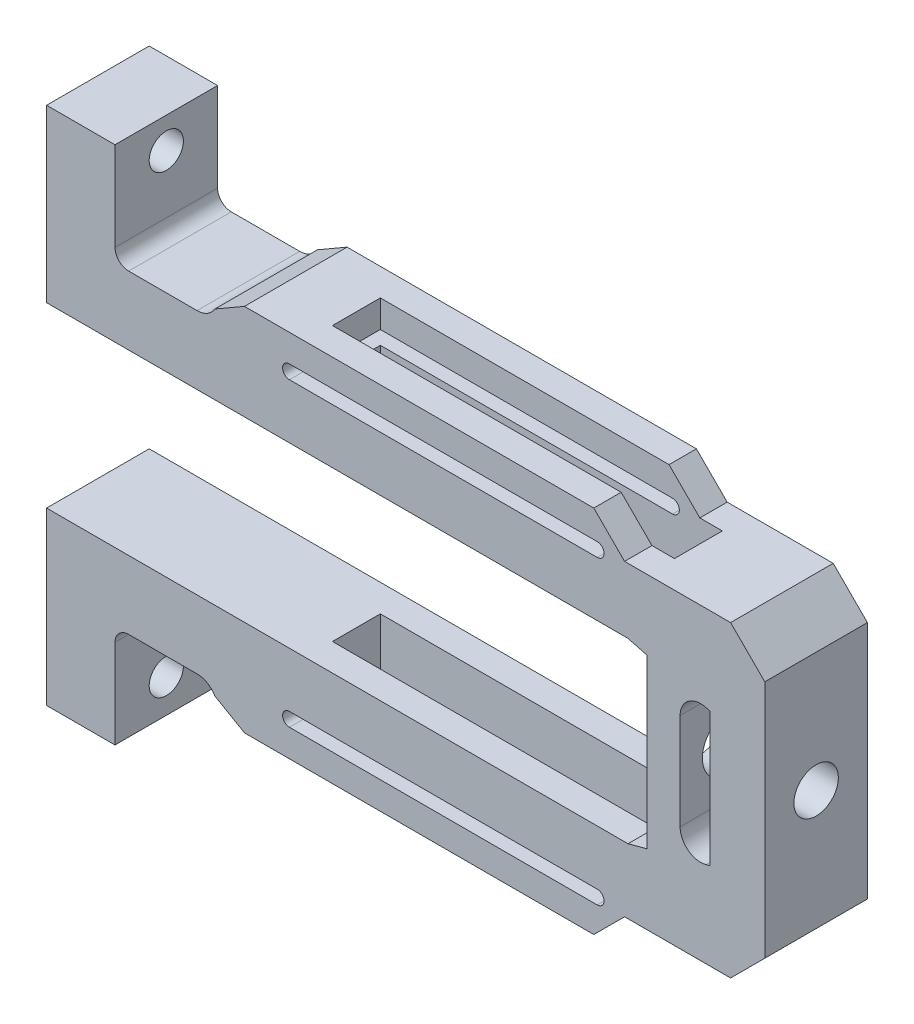
from build123d import *

# Parameters (mm, degrees)
BOSS_EXTRUDE1_DEPTH     = 7.5
SKETCH2_R               = 3.25
CUT_EXTRUDE1_DEPTH      = 112.91626334
FILLET1_R               = 2
SKETCH3_R               = 2.5
CUT_EXTRUDE2_DEPTH      = 103.592641062
CUT_EXTRUDE4_DEPTH      = 121.158229015
BOSS_EXTRUDE2_REACH     = 128.857
SKETCH7_W               = 5
SKETCH7_H               = 15
FILLET2_R               = 3
SKETCH8_R               = 4.25
CUT_EXTRUDE6_DEPTH      = 4.829629131
CUT_EXTRUDE3_DEPTH      = 125.202455692
CUT_EXTRUDE3_DEPTH_BACK = 125.202455692
SKETCH4_W               = 50
SKETCH4_H               = 7
CHAMFER1_START          = -7.5
CHAMFER1_DEPTH          = 15
CHAMFER2_SIZE           = 5


with BuildPart() as part:
    # Sketch1 → Boss-Extrude1 (new, symmetric)
    with BuildSketch(Plane.XY):
        Polygon((-28, 13), (-113, 13), (-113, 38), (-103, 38), (-103, 23), (-88, 23), (-88, 27), (-28, 27), (-28, 22.5), (-8, 22.5), (-8, -22.5), (-28, -22.5), (-28, -27), (-88, -27), (-88, -23), (-103, -23), (-103, -38), (-113, -38), (-113, -13), (-28, -13), (-16, -9.784609691), (-16, 9.784609691), align=None)
    extrude(amount=BOSS_EXTRUDE1_DEPTH, both=True)

    # Sketch2 → Cut-Extrude1 (cut, through all)
    with BuildSketch(Plane(origin=(-8, 0, 0), x_dir=(0, 0, -1), z_dir=(1, 0, 0))):
        Circle(SKETCH2_R)
    extrude(amount=-CUT_EXTRUDE1_DEPTH, mode=Mode.SUBTRACT)

    # Fillet1
    fillet1_edges = [part.edges().sort_by_distance(p)[0] for p in [
        (-103, -23, 0),
        (-103, 23, 0),
    ]]
    fillet(fillet1_edges, radius=FILLET1_R)

    # Sketch3 → Cut-Extrude2 (cut, through all)
    with BuildSketch(Plane(origin=(-103, 0, 0), x_dir=(0, 0, -1), z_dir=(1, 0, 0))):
        with Locations((0, 33.5)):
            Circle(SKETCH3_R)
        with Locations((0, -33)):
            Circle(SKETCH3_R)
    extrude(amount=-CUT_EXTRUDE2_DEPTH, mode=Mode.SUBTRACT)

    # Sketch5 → Cut-Extrude4 (cut, through all)
    with BuildSketch(Plane.XY.offset(7.5)):
        with BuildLine():
            Line((-77.5, 23.000000001), (-32.5, 23.000000001))
            ThreePointArc((-32.5, 23.000000001), (-31.5, 22.000000001), (-32.5, 21.000000001))
            Line((-32.5, 21.000000001), (-77.5, 21.000000001))
            ThreePointArc((-77.5, 21.000000001), (-78.5, 22.000000001), (-77.5, 23.000000001))
        make_face()
        with BuildLine():
            Line((-77.5, -23.000000001), (-32.5, -23.000000001))
            ThreePointArc((-32.5, -23.000000001), (-31.5, -22.000000001), (-32.5, -21.000000001))
            Line((-32.5, -21.000000001), (-77.5, -21.000000001))
            ThreePointArc((-77.5, -21.000000001), (-78.5, -22.000000001), (-77.5, -23.000000001))
        make_face()
    extrude(amount=-CUT_EXTRUDE4_DEPTH, mode=Mode.SUBTRACT)

    # Boss-Extrude2: up to this plane
    boss_extrude2_end = Plane(origin=(-16, -9.784609691, -7.5), z_dir=(-0.25881904510251796, 0.9659258262890691, 0))
    # Sketch7 → Boss-Extrude2 (add, up to the surface)
    with BuildSketch(Plane(origin=(1.374355653, 5.129165125, 0), x_dir=(-0.9659258262890691, 0.25881904510251813, 0), z_dir=(-0.25881904510251813, -0.9659258262890691, 0)), mode=Mode.PRIVATE) as boss_extrude2_sk1:
        with Locations((25.021910533, 0)):
            Rectangle(SKETCH7_W, SKETCH7_H)
    boss_extrude2_tool1 = split(extrude(boss_extrude2_sk1.sketch, amount=BOSS_EXTRUDE2_REACH, dir=(0, -1, 0), mode=Mode.PRIVATE), bisect_by=boss_extrude2_end, keep=Keep.BOTH, mode=Mode.PRIVATE)
    add(boss_extrude2_tool1.solids().sort_by_distance((-22.794954, 11.605312, 0))[0])

    # Fillet2
    fillet2_edges = [part.edges().sort_by_distance(p)[0] for p in [
        (-20.380139389, -10.958264503, 0),
        (-20.380139389, 10.958264503, 0),
        (-88, -23, 0),
        (-88, 23, 0),
    ]]
    fillet(fillet2_edges, radius=FILLET2_R)

    # Sketch8 → Cut-Extrude6 (cut)
    with BuildSketch(Plane.ZY.offset(25.20976852)):
        with Locations(Location((0, 0, 0), (0, 0, 270))):
            Circle(SKETCH8_R)
    extrude(amount=-CUT_EXTRUDE6_DEPTH, mode=Mode.SUBTRACT)

    # Sketch4 → Cut-Extrude3 (cut, two sides: drawn at the far end of the back side and taken through both)
    with BuildSketch(Plane(origin=(0, 13, 0), x_dir=(-1, 0, 0), z_dir=(0, -1, 0)).offset(-CUT_EXTRUDE3_DEPTH_BACK)):
        with Locations((50.20976852, 0)):
            Rectangle(SKETCH4_W, SKETCH4_H)
    extrude(amount=CUT_EXTRUDE3_DEPTH + CUT_EXTRUDE3_DEPTH_BACK, mode=Mode.SUBTRACT)

    # Chamfer1: read off the stored shape, not the designer's step
    # Chamfer1 outline → Chamfer1 (cut)
    with BuildSketch(Plane.XY.offset(CHAMFER1_START)):
        Polygon((-28, 27), (-33, 27), (-28.5, 22.5), (-28, 22.5), align=None)
        with BuildLine():
            Line((-88.401923788, 24.5), (-84.07179677, 27))
            Line((-84.07179677, 27), (-88, 27))
            Line((-88, 27), (-88, 26))
            ThreePointArc((-88, 26), (-88.102222521, 25.223542864), (-88.401923788, 24.5))
        make_face()
        Polygon((-28.5, -22.5), (-33, -27), (-28, -27), (-28, -22.5), align=None)
        with BuildLine():
            Line((-84.07179677, -27), (-88.401923788, -24.5))
            ThreePointArc((-88.401923788, -24.5), (-88.102222521, -25.223542864), (-88, -26))
            Line((-88, -26), (-88, -27))
            Line((-88, -27), (-84.07179677, -27))
        make_face()
    extrude(amount=CHAMFER1_DEPTH, mode=Mode.SUBTRACT)

    # Chamfer2
    chamfer2_edges = [part.edges().sort_by_distance(p)[0] for p in [
        (-8, 22.5, 0),
        (-8, -22.5, 0),
    ]]
    chamfer(chamfer2_edges, length=CHAMFER2_SIZE)


solid = part.part
